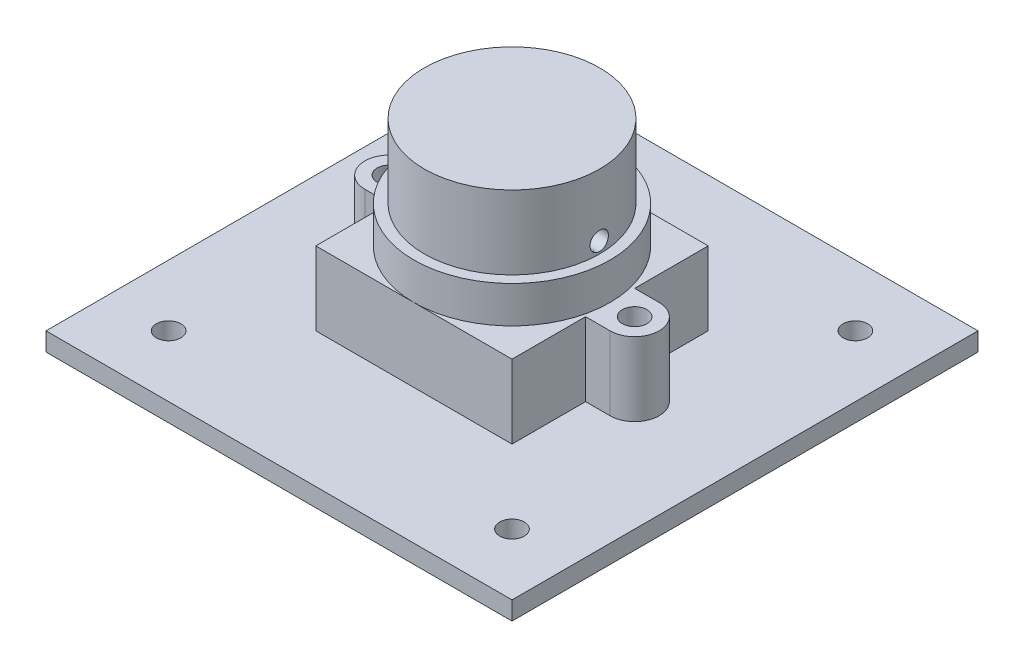
from build123d import *

# Parameters (mm, degrees)
SKETCH1_W                 = 38
SKETCH1_H                 = 38
BOSS_EXTRUDE1_DEPTH       = 1.5
SKETCH2_R                 = 1
BOSS_EXTRUDE2_DEPTH       = 6
SKETCH3_R                 = 8
BOSS_EXTRUDE3_DEPTH       = 3
SKETCH4_R                 = 1
CUT_EXTRUDE1_DEPTH        = 9
SKETCH5_R                 = 7.15
BOSS_EXTRUDE4_DEPTH       = 6
CUT_EXTRUDE2_REACH        = 35.532
CUT_EXTRUDE2_START_RADIUS = 7.15
CUT_EXTRUDE2_END_RADIUS   = 7.15
SKETCH6_R                 = 0.75


with BuildPart() as part:
    # Sketch1 → Boss-Extrude1 (new body)
    with BuildSketch(Plane(origin=(0, 0, 0), x_dir=(1, 0, 0), z_dir=(0, 1, 0))):
        Rectangle(SKETCH1_W, SKETCH1_H)
    extrude(amount=BOSS_EXTRUDE1_DEPTH)

    # Sketch2 → Boss-Extrude2 (add)
    with BuildSketch(Plane(origin=(0, 1.5, 0), x_dir=(1, 0, 0), z_dir=(0, 1, 0))):
        with BuildLine():
            Line((-10, 2), (-8, 2))
            Line((-8, 2), (-8, 8))
            Line((-8, 8), (8, 8))
            Line((8, 8), (8, 2))
            Line((8, 2), (10, 2))
            ThreePointArc((10, 2), (12, 0), (10, -2))
            Line((10, -2), (8, -2))
            Line((8, -2), (8, -8))
            Line((8, -8), (-8, -8))
            Line((-8, -8), (-8, -2))
            Line((-8, -2), (-10, -2))
            ThreePointArc((-10, -2), (-12, 0), (-10, 2))
        make_face()
        with Locations((-10, 0)):
            Circle(SKETCH2_R, mode=Mode.SUBTRACT)
        with Locations((10, 0)):
            Circle(SKETCH2_R, mode=Mode.SUBTRACT)
    extrude(amount=BOSS_EXTRUDE2_DEPTH)

    # Sketch3 → Boss-Extrude3 (add)
    with BuildSketch(Plane(origin=(0, 7.5, 0), x_dir=(1, 0, 0), z_dir=(0, 1, 0))):
        Circle(SKETCH3_R)
    extrude(amount=BOSS_EXTRUDE3_DEPTH)

    # Sketch4 → Cut-Extrude1 (cut)
    with BuildSketch(Plane(origin=(0, 1.5, 0), x_dir=(1, 0, 0), z_dir=(0, 1, 0))):
        with Locations((14, 14)):
            Circle(SKETCH4_R)
        with Locations((-14, 14)):
            Circle(SKETCH4_R)
        with Locations((14, -14)):
            Circle(SKETCH4_R)
        with Locations((-14, -14)):
            Circle(SKETCH4_R)
    extrude(amount=-CUT_EXTRUDE1_DEPTH, mode=Mode.SUBTRACT)

    # Sketch5 → Boss-Extrude4 (add)
    with BuildSketch(Plane(origin=(0, 10.5, 0), x_dir=(1, 0, 0), z_dir=(0, 1, 0))):
        Circle(SKETCH5_R)
    extrude(amount=BOSS_EXTRUDE4_DEPTH)

    # Cut-Extrude2: from a cylinder face, 35.532 long prism both ways, kept between that surface and its translate by the depth
    cut_extrude2_start = Plane(origin=(0, 11.432941, 0), z_dir=(0, -1, 0)) * Cylinder(CUT_EXTRUDE2_START_RADIUS, 86.364, mode=Mode.PRIVATE)
    cut_extrude2_end = Plane(origin=(-2, 11.432941, 0), z_dir=(0, -1, 0)) * Cylinder(CUT_EXTRUDE2_END_RADIUS, 86.364, mode=Mode.PRIVATE)
    # Sketch6 → Cut-Extrude2 (cut, from a surface)
    with BuildSketch(Plane(origin=(0, 0, 0), x_dir=(0, 0, -1), z_dir=(1, 0, 0)), mode=Mode.PRIVATE) as cut_extrude2_sk1:
        with Locations((0, 11.432941468)):
            Circle(SKETCH6_R)
    cut_extrude2_tool1 = extrude(cut_extrude2_sk1.sketch, amount=CUT_EXTRUDE2_REACH, both=True, mode=Mode.PRIVATE)
    add(((cut_extrude2_tool1 & cut_extrude2_start) - cut_extrude2_end).solids().sort_by_distance((0, 16.5, 7.15))[0], mode=Mode.SUBTRACT)


solid = part.part
